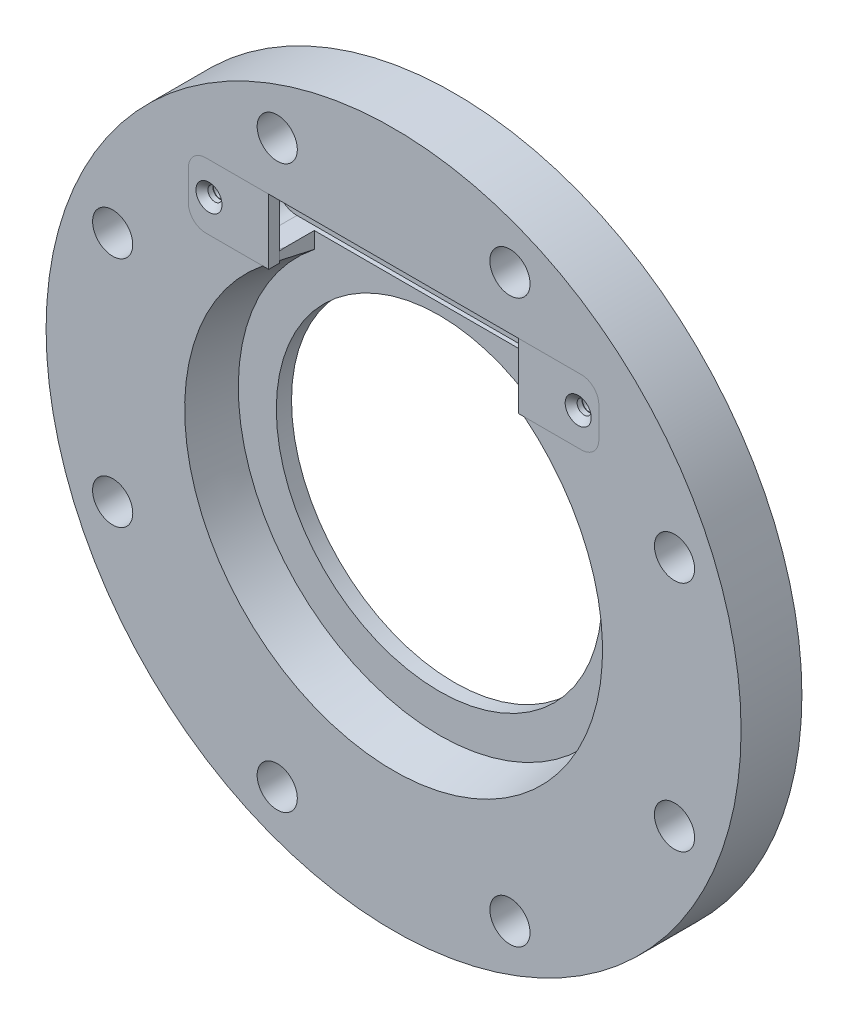
from build123d import *

# Parameters (mm, degrees)
SKETCH1_R               = 160
SKETCH1_R_2             = 75
SKETCH1_R_3             = 9.25
BOSS_EXTRUDE1_DEPTH     = 14
SKETCH2_R               = 92.5
CUT_EXTRUDE1_DEPTH      = 21
SKETCH14_R              = 92.5
CUT_EXTRUDE3_DEPTH      = 50
CUT_EXTRUDE3_DRAFT      = -10
CUT_EXTRUDE2_DEPTH      = 50
CUT_EXTRUDE2_DEPTH_BACK = 9
SKETCH3_W               = 155
SKETCH3_H               = 20
FILLET1_R               = 2
CUT_EXTRUDE4_DEPTH      = 5
SKETCH19_R              = 3
CUT_EXTRUDE5_DEPTH      = 20
CHAMFER1_SIZE           = 3
FILLET2_R               = 10
CUT_EXTRUDE6_DEPTH      = 160
CUT_EXTRUDE6_DEPTH_BACK = 16
SKETCH20_W              = 21.849422398
SKETCH20_H              = 17.680771646
SKETCH22_R              = 3.25
BOSS_EXTRUDE2_DEPTH     = 5
SKETCH23_R              = 6
CUT_EXTRUDE7_DEPTH      = 5
CUT_EXTRUDE7_DRAFT      = -45
SKETCH24_W              = 115
SKETCH24_H              = 5
CUT_EXTRUDE8_DEPTH      = 5


with BuildPart() as part:
    # Sketch1 → Boss-Extrude1 (new, symmetric)
    with BuildSketch(Plane.XY):
        Circle(SKETCH1_R)
        Circle(SKETCH1_R_2, mode=Mode.SUBTRACT)
        with Locations((-53.575680531, 129.343134552)):
            Circle(SKETCH1_R_3, mode=Mode.SUBTRACT)
        with Locations((53.575680531, 129.343134552)):
            Circle(SKETCH1_R_3, mode=Mode.SUBTRACT)
        with Locations((129.343134552, 53.575680531)):
            Circle(SKETCH1_R_3, mode=Mode.SUBTRACT)
        with Locations((129.343134552, -53.575680531)):
            Circle(SKETCH1_R_3, mode=Mode.SUBTRACT)
        with Locations((53.575680531, -129.343134552)):
            Circle(SKETCH1_R_3, mode=Mode.SUBTRACT)
        with Locations((-53.575680531, -129.343134552)):
            Circle(SKETCH1_R_3, mode=Mode.SUBTRACT)
        with Locations((-129.343134552, -53.575680531)):
            Circle(SKETCH1_R_3, mode=Mode.SUBTRACT)
        with Locations((-129.343134552, 53.575680531)):
            Circle(SKETCH1_R_3, mode=Mode.SUBTRACT)
    extrude(amount=BOSS_EXTRUDE1_DEPTH, both=True)

    # Sketch2 → Cut-Extrude1 (cut)
    with BuildSketch(Plane.XY.offset(14)):
        Circle(SKETCH2_R)
    extrude(amount=-CUT_EXTRUDE1_DEPTH, mode=Mode.SUBTRACT)


with BuildPart() as cut_extrude3_tool:
    # Sketch14 → Cut-Extrude3 (with draft: the straight prism first)
    with BuildSketch(Plane.XY.offset(-7)):
        Circle(SKETCH14_R)
    extrude(amount=CUT_EXTRUDE3_DEPTH)
    # Cut-Extrude3: the draft: its side faces are tilted about the plane it starts from
    cut_extrude3_sides = [cut_extrude3_tool.faces().sort_by_distance(p)[0] for p in [
        (-92.5, 0, 18),
    ]]
    draft(cut_extrude3_sides, Plane.XY.offset(-7), CUT_EXTRUDE3_DRAFT)


with BuildPart() as part_1:
    add(part.part)

    # Cut-Extrude3: cut by cut_extrude3_tool
    add(cut_extrude3_tool.part, mode=Mode.SUBTRACT)

    # Sketch3 → Cut-Extrude2 (cut, two sides: drawn at the far end of the back side and taken through both)
    with BuildSketch(Plane.XY.offset(-CUT_EXTRUDE2_DEPTH_BACK)):
        with Locations((0, 90)):
            Rectangle(SKETCH3_W, SKETCH3_H)
    extrude(amount=CUT_EXTRUDE2_DEPTH + CUT_EXTRUDE2_DEPTH_BACK, mode=Mode.SUBTRACT)

    # Fillet1
    fillet1_edges = [part_1.edges().sort_by_distance(p)[0] for p in [
        (-50.013124826, 80, 3.47354247),
        (50.013124826, 80, 3.47354247),
    ]]
    fillet(fillet1_edges, radius=FILLET1_R)

    # Sketch18 → Cut-Extrude4 (cut)
    with BuildSketch(Plane.XY.offset(14)):
        with BuildLine():
            Line((-86.5, 75), (-57.5, 75))
            Line((-57.5, 75), (-57.5, 105))
            Line((-57.5, 105), (-86.5, 105))
            ThreePointArc((-86.5, 105), (-92.156854249, 102.656854249), (-94.5, 97))
            Line((-94.5, 97), (-94.5, 83))
            ThreePointArc((-94.5, 83), (-92.156854249, 77.343145751), (-86.5, 75))
        make_face()
        with BuildLine():
            Line((86.5, 105), (57.5, 105))
            Line((57.5, 105), (57.5, 75))
            Line((57.5, 75), (86.5, 75))
            ThreePointArc((86.5, 75), (92.156854249, 77.343145751), (94.5, 83))
            Line((94.5, 83), (94.5, 97))
            ThreePointArc((94.5, 97), (92.156854249, 102.656854249), (86.5, 105))
        make_face()
    extrude(amount=-CUT_EXTRUDE4_DEPTH, mode=Mode.SUBTRACT)

    # Sketch19 → Cut-Extrude5 (cut)
    with BuildSketch(Plane.XY.offset(9)):
        with Locations((-85, 90)):
            Circle(SKETCH19_R)
        with Locations(Location((85, 90, 0), (0, 0, 180))):
            Circle(SKETCH19_R)
    extrude(amount=-CUT_EXTRUDE5_DEPTH, mode=Mode.SUBTRACT)

    # Chamfer1
    chamfer1_edges = [part_1.edges().sort_by_distance(p)[0] for p in [
        (-88, 90, -11),
        (88, 90, -11),
    ]]
    chamfer(chamfer1_edges, length=CHAMFER1_SIZE)

    # Fillet2
    fillet2_edges = [part_1.edges().sort_by_distance(p)[0] for p in [
        (-77.5, 80, 0),
        (-77.5, 100, 0),
        (77.5, 80, 0),
        (77.5, 100, 0),
    ]]
    fillet(fillet2_edges, radius=FILLET2_R - 0.0001)  # a hair under: the kernel refuses the full size

    # Sketch20 → Cut-Extrude6 (cut, two sides: drawn at the far end of the back side and taken through both)
    with BuildSketch(Plane.XY.offset(9).offset(-CUT_EXTRUDE6_DEPTH_BACK)):
        with Locations((-46.575288801, 78.544807518)):
            Rectangle(SKETCH20_W, SKETCH20_H)
        with Locations((46.575288801, 78.544807518)):
            Rectangle(SKETCH20_W, SKETCH20_H)
    extrude(amount=CUT_EXTRUDE6_DEPTH + CUT_EXTRUDE6_DEPTH_BACK, mode=Mode.SUBTRACT)

    # Sketch24 → Cut-Extrude8 (cut)
    with BuildSketch(Plane.XY.offset(14)):
        with Locations((0, 102.5)):
            Rectangle(SKETCH24_W, SKETCH24_H)
    extrude(amount=-CUT_EXTRUDE8_DEPTH, mode=Mode.SUBTRACT)


with BuildPart() as body_2:
    # Sketch22 → Boss-Extrude2 (new body)
    with BuildSketch(Plane.XY.offset(9)):
        with BuildLine():
            Line((-57.5, 105), (-86.5, 105))
            ThreePointArc((-86.5, 105), (-92.156854249, 102.656854249), (-94.5, 97))
            Line((-94.5, 97), (-94.5, 83))
            ThreePointArc((-94.5, 83), (-92.156854249, 77.343145751), (-86.5, 75))
            Line((-86.5, 75), (-57.5, 75))
            Line((-57.5, 75), (-57.5, 105))
        make_face()
        with Locations((-85, 90)):
            Circle(SKETCH22_R, mode=Mode.SUBTRACT)
    extrude(amount=BOSS_EXTRUDE2_DEPTH)


with BuildPart() as cut_extrude7_tool:
    # Sketch23 → Cut-Extrude7 (with draft: the straight prism first)
    with BuildSketch(Plane.XY.offset(14)):
        with Locations((-85, 90)):
            Circle(SKETCH23_R)
    extrude(amount=-CUT_EXTRUDE7_DEPTH)
    # Cut-Extrude7: the draft: its side faces are tilted about the plane it starts from
    cut_extrude7_sides = [cut_extrude7_tool.faces().sort_by_distance(p)[0] for p in [
        (-91, 90, 11.5),
    ]]
    draft(cut_extrude7_sides, Plane.XY.offset(14), CUT_EXTRUDE7_DRAFT)


with BuildPart() as body_2_1:
    add(body_2.part)

    # Cut-Extrude7: cut by cut_extrude7_tool
    add(cut_extrude7_tool.part, mode=Mode.SUBTRACT)


with BuildPart() as body_3:
    # Mirror1: mirrored copy
    add(body_2_1.part.mirror(Plane(origin=(0, 0, 0), x_dir=(0, 0, 1), z_dir=(1, 0, 0))))


solid = Compound([part_1.part, body_2_1.part, body_3.part])
